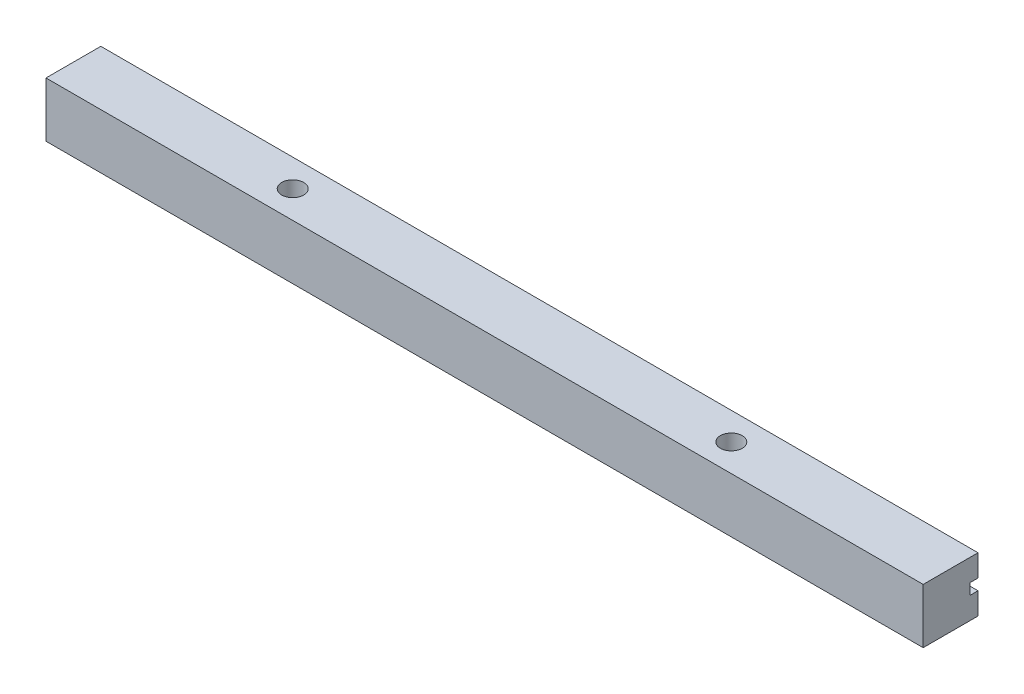
from build123d import *

# Parameters (mm, degrees)
SKETCH1_W           = 160
SKETCH1_H           = 10
BOSS_EXTRUDE1_DEPTH = 10
SKETCH2_R           = 2
CUT_EXTRUDE1_DEPTH  = 161.623784042
SKETCH5_W           = 1.5
SKETCH5_H           = 2
CUT_EXTRUDE4_DEPTH  = 161.623784042


with BuildPart() as part:
    # Sketch1 → Boss-Extrude1 (new body)
    with BuildSketch(Plane.XY):
        with Locations((80, 5)):
            Rectangle(SKETCH1_W, SKETCH1_H)
    extrude(amount=BOSS_EXTRUDE1_DEPTH)

    # Sketch2 → Cut-Extrude1 (cut, through all)
    with BuildSketch(Plane.XZ):
        with Locations((40, 5)):
            Circle(SKETCH2_R)
        with Locations((120, 5)):
            Circle(SKETCH2_R)
    extrude(amount=-CUT_EXTRUDE1_DEPTH, mode=Mode.SUBTRACT)

    # Sketch5 → Cut-Extrude4 (cut, through all)
    with BuildSketch(Plane.ZY):
        with Locations((0.75, 5)):
            Rectangle(SKETCH5_W, SKETCH5_H)
    extrude(amount=-CUT_EXTRUDE4_DEPTH, mode=Mode.SUBTRACT)


solid = part.part
